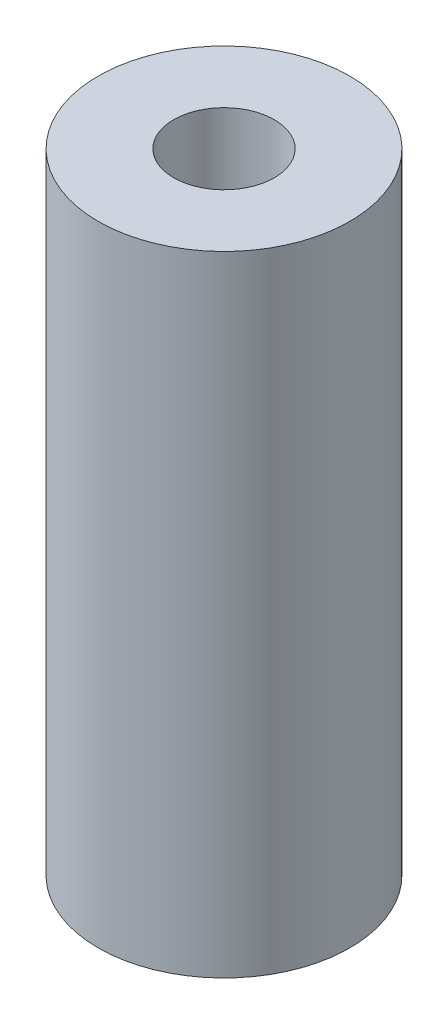
from build123d import *

# Parameters (mm, degrees)
SKETCH1_R           = 2.5
SKETCH1_R_2         = 1
BOSS_EXTRUDE1_DEPTH = 12.5


with BuildPart() as part:
    # Sketch1 → Boss-Extrude1 (new body)
    with BuildSketch(Plane(origin=(0, 0, 0), x_dir=(1, 0, 0), z_dir=(0, 1, 0))):
        Circle(SKETCH1_R)
        Circle(SKETCH1_R_2, mode=Mode.SUBTRACT)
    extrude(amount=BOSS_EXTRUDE1_DEPTH)


solid = part.part
